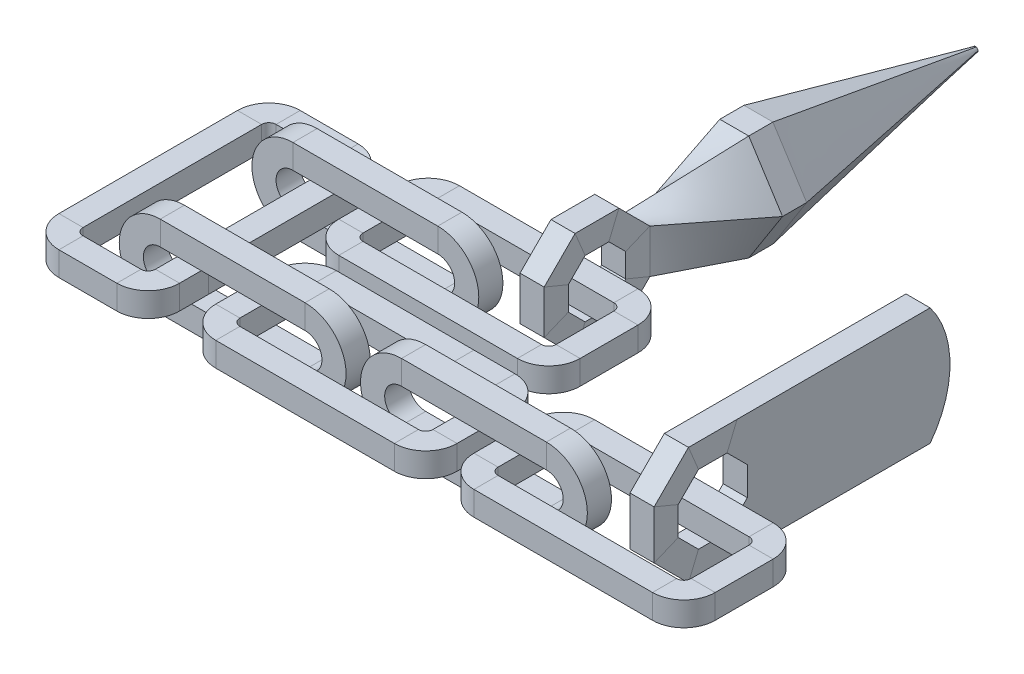
from build123d import *

# Parameters (mm, degrees)
CROQUIS2_W              = 5
CROQUIS2_H              = 5
CROQUIS8_W              = 5
CROQUIS8_H              = 5
CROQUIS11_W             = 5
CROQUIS11_H             = 5
CROQUIS17_W             = 5
CROQUIS17_H             = 5
CROQUIS19_W             = 5
CROQUIS19_H             = 5
CROQUIS22_W             = 5
CROQUIS22_H             = 5
CROQUIS28_W             = 5
CROQUIS28_H             = 5
SALIENTE_EXTRUIR2_DEPTH = 5
CROQUIS35_W             = 5
CROQUIS35_H             = 5
CROQUIS37_W             = 5
CROQUIS37_H             = 5
SALIENTE_EXTRUIR4_START = -5
SALIENTE_EXTRUIR4_DEPTH = 5


with BuildPart() as part:
    # Barrer1: sweep along a path in Croquis1
    with BuildLine(Plane.XY) as barrer1_path:
        Line((0, 0), (30, 0))
        ThreePointArc((30, 0), (36, 6), (30, 12))
        Line((30, 12), (0, 12))
        ThreePointArc((0, 12), (-6, 6), (0, 0))
    # Croquis2 → Barrer1 (sweep)
    with BuildSketch(Plane(origin=(0, 0, 0), x_dir=(0, 0, -1), z_dir=(1, 0, 0))):
        with Locations((0, 12)):
            Rectangle(CROQUIS2_W, CROQUIS2_H)
    sweep(path=barrer1_path.line)


with BuildPart() as body_2:
    # Barrer2: sweep along a path in Croquis7
    with BuildLine(Plane(origin=(0, 6, 0), x_dir=(1, 0, 0), z_dir=(0, 1, 0))) as barrer2_path:
        Line((-28.5, 10), (8.5, 10))
        ThreePointArc((8.5, 10), (11.328427125, 8.828427125), (12.5, 6))
        Line((12.5, 6), (12.5, -6))
        ThreePointArc((12.5, -6), (11.328427125, -8.828427125), (8.5, -10))
        Line((8.5, -10), (-28.5, -10))
        ThreePointArc((-28.5, -10), (-31.328427125, -8.828427125), (-32.5, -6))
        Line((-32.5, -6), (-32.5, 6))
        ThreePointArc((-32.5, 6), (-31.328427125, 8.828427125), (-28.5, 10))
    # Croquis8 → Barrer2 (sweep)
    with BuildSketch(Plane(origin=(0, 0, 0), x_dir=(0, 0, -1), z_dir=(1, 0, 0))):
        with Locations((10, 6)):
            Rectangle(CROQUIS8_W, CROQUIS8_H)
    sweep(path=barrer2_path.line)


with BuildPart() as body_3:
    # Barrer3: sweep along a path in Croquis10
    with BuildLine(Plane.XY) as barrer3_path:
        Line((-50, 0), (-20, 0))
        ThreePointArc((-20, 0), (-14, 6), (-20, 12))
        Line((-20, 12), (-50, 12))
        ThreePointArc((-50, 12), (-56, 6), (-50, 0))
    # Croquis11 → Barrer3 (sweep)
    with BuildSketch(Plane(origin=(-50, 0, 0), x_dir=(0, 0, -1), z_dir=(1, 0, 0))):
        with Locations((0, 12)):
            Rectangle(CROQUIS11_W, CROQUIS11_H)
    sweep(path=barrer3_path.line)


with BuildPart() as body_4:
    # Barrer6: sweep along a path in Croquis16
    with BuildLine(Plane(origin=(0, 6, 0), x_dir=(1, 0, 0), z_dir=(0, 1, 0))) as barrer6_path:
        Line((-45, 0), (-45, -6))
        ThreePointArc((-45, -6), (-46.171572875, -8.828427125), (-49, -10))
        Line((-49, -10), (-61, -10))
        ThreePointArc((-61, -10), (-63.828427125, -8.828427125), (-65, -6))
        Line((-65, -6), (-65, 31))
        ThreePointArc((-65, 31), (-63.828427125, 33.828427125), (-61, 35))
        Line((-61, 35), (-49, 35))
        ThreePointArc((-49, 35), (-46.171572875, 33.828427125), (-45, 31))
        Line((-45, 31), (-45, 0))
    # Croquis17 → Barrer6 (sweep)
    with BuildSketch(Plane.XY.offset(-31)):
        with Locations((-65, 6)):
            Rectangle(CROQUIS17_W, CROQUIS17_H)
    sweep(path=barrer6_path.line)


with BuildPart() as body_5:
    # Barrer7: sweep along a path in Croquis18
    with BuildLine(Plane(origin=(0, 0, -27.5), x_dir=(-1, 0, 0), z_dir=(0, 0, -1))) as barrer7_path:
        Line((20, 0), (50, 0))
        ThreePointArc((50, 0), (56, 6), (50, 12))
        Line((50, 12), (20, 12))
        ThreePointArc((20, 12), (14, 6), (20, 0))
    # Croquis19 → Barrer7 (sweep)
    with BuildSketch(Plane(origin=(-20, 0, 0), x_dir=(0, 0, -1), z_dir=(1, 0, 0))):
        with Locations((27.5, 0)):
            Rectangle(CROQUIS19_W, CROQUIS19_H)
    sweep(path=barrer7_path.line)


with BuildPart() as body_6:
    # Barrer8: sweep along a path in Croquis21
    with BuildLine(Plane(origin=(0, 6, 0), x_dir=(1, 0, 0), z_dir=(0, 1, 0))) as barrer8_path:
        Line((-31, 37.996379446), (6, 37.996379446))
        ThreePointArc((6, 37.996379446), (8.828427125, 36.824806571), (10, 33.996379446))
        Line((10, 33.996379446), (10, 21.996379446))
        ThreePointArc((10, 21.996379446), (8.828427125, 19.167952321), (6, 17.996379446))
        Line((6, 17.996379446), (-31, 17.996379446))
        ThreePointArc((-31, 17.996379446), (-33.828427125, 19.167952321), (-35, 21.996379446))
        Line((-35, 21.996379446), (-35, 33.996379446))
        ThreePointArc((-35, 33.996379446), (-33.828427125, 36.824806571), (-31, 37.996379446))
    # Croquis22 → Barrer8 (sweep)
    with BuildSketch(Plane(origin=(6, 0, 0), x_dir=(0, 0, -1), z_dir=(1, 0, 0))):
        with Locations((37.996379446, 6)):
            Rectangle(CROQUIS22_W, CROQUIS22_H)
    sweep(path=barrer8_path.line)


with BuildPart() as body_7:
    # Barrer11: sweep along a path in Croquis24
    with BuildLine(Plane(origin=(-2, 0, 0), x_dir=(0, 0, -1), z_dir=(1, 0, 0))) as barrer11_path:
        Line((33.996379446, 0.050252532), (40.996379446, 0.050252532))
        Line((40.996379446, 0.050252532), (45.946126914, 5))
        Line((45.946126914, 5), (45.946126914, 12))
        Line((45.946126914, 12), (40.996379446, 16.949747468))
        Line((40.996379446, 16.949747468), (33.996379446, 16.949747468))
        Line((33.996379446, 16.949747468), (29.046631978, 12))
        Line((29.046631978, 12), (29.046631978, 5))
        Line((29.046631978, 5), (33.996379446, 0.050252532))
    # Croquis28 → Barrer11 (sweep)
    with BuildSketch(Plane(origin=(0, 12, 0), x_dir=(1, 0, 0), z_dir=(0, 1, 0))):
        with Locations((-2, 45.946126914)):
            Rectangle(CROQUIS28_W, CROQUIS28_H)
    sweep(path=barrer11_path.line, transition=Transition.RIGHT)

    # Recubrir1: read off the stored shape, not the designer's step
    # Recubrir1: loft between two sections, ruled curve by curve
    recubrir1_from = [
        Edge.make_bspline([(8, 8.5, -68.446126914), (1, 19.449747468, -68.446126914)], [0, 0, 1, 1], 1),
        Edge.make_bspline([(1, 19.449747468, -68.446126914), (0.75, 19.449747468, -68.446126914), (0.25, 19.449747468, -68.446126914), (-0.5, 19.449747468, -68.446126914), (-1.25, 19.449747468, -68.446126914), (-1.75, 19.449747468, -68.446126914), (-2.25, 19.449747468, -68.446126914), (-2.75, 19.449747468, -68.446126914), (-3.5, 19.449747468, -68.446126914), (-4.25, 19.449747468, -68.446126914), (-4.75, 19.449747468, -68.446126914), (-5, 19.449747468, -68.446126914)], [0, 0, 0, 0, 0.125, 0.25, 0.375, 0.5, 0.5, 0.625, 0.75, 0.875, 1, 1, 1, 1], 3),
        Edge.make_bspline([(1, -2.449747468, -68.446126914), (8, 8.5, -68.446126914)], [0, 0, 1, 1], 1),
        Edge.make_bspline([(-5, 19.449747468, -68.446126914), (-12, 8.5, -68.446126914)], [0, 0, 1, 1], 1),
        Edge.make_bspline([(-12, 8.5, -68.446126914), (-5, -2.449747468, -68.446126914)], [0, 0, 1, 1], 1),
        Edge.make_line((-5, -2.449747468, -68.446126914), (1, -2.449747468, -68.446126914)),
    ]
    recubrir1_to = [
        Edge.make_bspline([(0.5, 13.035533906, -48.446126914), (-4.5, 13.035533906, -48.446126914)], [0, 0, 1, 1], 1),
        Edge.make_bspline([(-4.5, 13.035533906, -48.446126914), (-4.5, 12.916152848, -48.446126914), (-4.5, 12.677390733, -48.446126914), (-4.5, 12.319247559, -48.446126914), (-4.5, 11.961104386, -48.446126914), (-4.5, 11.722342271, -48.446126914), (-4.5, 11.483580155, -48.446126914), (-4.5, 11.24481804, -48.446126914), (-4.5, 10.886674866, -48.446126914), (-4.5, 10.528531693, -48.446126914), (-4.5, 10.289769578, -48.446126914), (-4.5, 10.17038852, -48.446126914)], [0, 0, 0, 0, 0.125, 0.25, 0.375, 0.5, 0.5, 0.625, 0.75, 0.875, 1, 1, 1, 1], 3),
        Edge.make_bspline([(0.5, 3.964466094, -48.446126914), (0.5, 13.035533906, -48.446126914)], [0, 0, 1, 1], 1),
        Edge.make_bspline([(-4.5, 10.17038852, -48.446126914), (-4.5, 3.964466094, -48.446126914)], [0, 0, 1, 1], 1),
        Edge.make_bspline([(-4.5, 3.964466094, -48.446126914), (-1.079276798, 3.964466094, -48.446126914)], [0, 0, 1, 1], 1),
        Edge.make_line((-1.079276798, 3.964466094, -48.446126914), (0.5, 3.964466094, -48.446126914)),
    ]
    recubrir1 = Solid(Shell([*[Face.make_surface_from_curves(recubrir1_from[k], recubrir1_to[k]) for k in range(6)], Face(Wire(recubrir1_from)), Face(Wire(recubrir1_to))]))
    add(recubrir1)

    # Croquis31 → Saliente-Extruir2 (add)
    with BuildSketch(Plane(origin=(0, 0, -68.446126914), x_dir=(-1, 0, 0), z_dir=(0, 0, -1))):
        Polygon((-1, 19.449747468), (2, 19.449747468), (5, 19.449747468), (12, 8.5), (5, -2.449747468), (2, -2.449747468), (-1, -2.449747468), (-8, 8.5), align=None)
    extrude(amount=SALIENTE_EXTRUIR2_DEPTH)

    # Recubrir2: read off the stored shape, not the designer's step
    # Recubrir2: loft between two sections, ruled curve by curve
    recubrir2_from = [
        Edge.make_bspline([(-1.5, 8.5, -118.446126914), (-1.5, 8.601088464, -118.446126914), (-1.534156666, 8.713718085, -118.446126914), (-1.670783331, 8.892812699, -118.446126914), (-1.770384142, 8.955516669, -118.446126914), (-1.867879592, 8.982228367, -118.446126914)], [0, 0, 0, 0, 0.5, 0.5, 1, 1, 1, 1], 3),
        Edge.make_bspline([(-1.867879592, 8.982228367, -118.446126914), (-1.910354398, 8.993865568, -118.446126914), (-1.955177199, 8.999684169, -118.446126914), (-2.044822801, 8.999684169, -118.446126914), (-2.089645602, 8.993865568, -118.446126914), (-2.132120408, 8.982228367, -118.446126914)], [0, 0, 0, 0, 0.5, 0.5, 1, 1, 1, 1], 3),
        Edge.make_bspline([(-1.867879592, 8.017771633, -118.446126914), (-1.770384142, 8.044483331, -118.446126914), (-1.670783331, 8.107187301, -118.446126914), (-1.534156666, 8.286281915, -118.446126914), (-1.5, 8.398911536, -118.446126914), (-1.5, 8.5, -118.446126914)], [0, 0, 0, 0, 0.5, 0.5, 1, 1, 1, 1], 3),
        Edge.make_bspline([(-2.132120408, 8.982228367, -118.446126914), (-2.229615858, 8.955516669, -118.446126914), (-2.329216669, 8.892812699, -118.446126914), (-2.465843334, 8.713718085, -118.446126914), (-2.5, 8.601088464, -118.446126914), (-2.5, 8.5, -118.446126914)], [0, 0, 0, 0, 0.5, 0.5, 1, 1, 1, 1], 3),
        Edge.make_bspline([(-2.5, 8.5, -118.446126914), (-2.5, 8.398911536, -118.446126914), (-2.465843334, 8.286281915, -118.446126914), (-2.329216669, 8.107187301, -118.446126914), (-2.229615858, 8.044483331, -118.446126914), (-2.132120408, 8.017771633, -118.446126914)], [0, 0, 0, 0, 0.5, 0.5, 1, 1, 1, 1], 3),
        Edge.make_bspline([(-2.132120408, 8.017771633, -118.446126914), (-2.089645602, 8.006134432, -118.446126914), (-2.044822801, 8.000315831, -118.446126914), (-1.955177199, 8.000315831, -118.446126914), (-1.910354398, 8.006134432, -118.446126914), (-1.867879592, 8.017771633, -118.446126914)], [0, 0, 0, 0, 0.5, 0.5, 1, 1, 1, 1], 3),
    ]
    recubrir2_to = [
        Edge.make_bspline([(8, 8.5, -73.446126914), (6.833333333, 10.324957911, -73.446126914), (5.666666667, 12.149915823, -73.446126914), (3.333333333, 15.799831646, -73.446126914), (2.166666667, 17.624789557, -73.446126914), (1, 19.449747468, -73.446126914)], [0, 0, 0, 0, 0.5, 0.5, 1, 1, 1, 1], 3),
        Edge.make_bspline([(1, 19.449747468, -73.446126914), (0, 19.449747468, -73.446126914), (-1, 19.449747468, -73.446126914), (-3, 19.449747468, -73.446126914), (-4, 19.449747468, -73.446126914), (-5, 19.449747468, -73.446126914)], [0, 0, 0, 0, 0.5, 0.5, 1, 1, 1, 1], 3),
        Edge.make_bspline([(1, -2.449747468, -73.446126914), (2.166666667, -0.624789557, -73.446126914), (3.333333333, 1.200168354, -73.446126914), (5.666666667, 4.850084177, -73.446126914), (6.833333333, 6.675042089, -73.446126914), (8, 8.5, -73.446126914)], [0, 0, 0, 0, 0.5, 0.5, 1, 1, 1, 1], 3),
        Edge.make_bspline([(-5, 19.449747468, -73.446126914), (-6.166666667, 17.624789557, -73.446126914), (-7.333333333, 15.799831646, -73.446126914), (-9.666666667, 12.149915823, -73.446126914), (-10.833333333, 10.324957911, -73.446126914), (-12, 8.5, -73.446126914)], [0, 0, 0, 0, 0.5, 0.5, 1, 1, 1, 1], 3),
        Edge.make_bspline([(-12, 8.5, -73.446126914), (-10.833333333, 6.675042089, -73.446126914), (-9.666666667, 4.850084177, -73.446126914), (-7.333333333, 1.200168354, -73.446126914), (-6.166666667, -0.624789557, -73.446126914), (-5, -2.449747468, -73.446126914)], [0, 0, 0, 0, 0.5, 0.5, 1, 1, 1, 1], 3),
        Edge.make_bspline([(-5, -2.449747468, -73.446126914), (-4, -2.449747468, -73.446126914), (-3, -2.449747468, -73.446126914), (-1, -2.449747468, -73.446126914), (0, -2.449747468, -73.446126914), (1, -2.449747468, -73.446126914)], [0, 0, 0, 0, 0.5, 0.5, 1, 1, 1, 1], 3),
    ]
    recubrir2 = Solid(Shell([*[Face.make_surface_from_curves(recubrir2_from[k], recubrir2_to[k]) for k in range(6)], Face(Wire(recubrir2_from)), Face(Wire(recubrir2_to))]))
    add(recubrir2)


with BuildPart() as body_8:
    # Barrer13: sweep along a path in Croquis14
    with BuildLine(Plane(origin=(0, 6, 0), x_dir=(1, 0, 0), z_dir=(0, 1, 0))) as barrer13_path:
        Line((25, 10), (62, 10))
        ThreePointArc((62, 10), (64.828427125, 8.828427125), (66, 6))
        Line((66, 6), (66, -6))
        ThreePointArc((66, -6), (64.828427125, -8.828427125), (62, -10))
        Line((62, -10), (25, -10))
        ThreePointArc((25, -10), (22.171572875, -8.828427125), (21, -6))
        Line((21, -6), (21, 6))
        ThreePointArc((21, 6), (22.171572875, 8.828427125), (25, 10))
    # Croquis35 → Barrer13 (sweep)
    with BuildSketch(Plane(origin=(43.5, 0, 0), x_dir=(0, 0, -1), z_dir=(1, 0, 0))):
        with Locations((10, 6)):
            Rectangle(CROQUIS35_W, CROQUIS35_H)
    sweep(path=barrer13_path.line)


with BuildPart() as body_9:
    # Barrer14: sweep along a path in Croquis36
    with BuildLine(Plane(origin=(50.5, 0, 0), x_dir=(0, 0, -1), z_dir=(1, 0, 0))) as barrer14_path:
        Line((-0.666503965, 5.656854249), (4.990350284, 0))
        Line((4.990350284, 0), (12.990350284, 0))
        Line((12.990350284, 0), (18.647204534, 5.656854249))
        Line((18.647204534, 5.656854249), (18.647204534, 13.656854249))
        Line((18.647204534, 13.656854249), (12.990350284, 19.313708499))
        Line((12.990350284, 19.313708499), (4.990350284, 19.313708499))
        Line((4.990350284, 19.313708499), (-0.666503965, 13.656854249))
        Line((-0.666503965, 13.656854249), (-0.666503965, 5.656854249))
    # Croquis37 → Barrer14 (sweep)
    with BuildSketch(Plane(origin=(0, 0, -12.990350284), x_dir=(-1, 0, 0), z_dir=(0, 0, -1))):
        with Locations((-50.5, 19.313708499)):
            Rectangle(CROQUIS37_W, CROQUIS37_H)
    sweep(path=barrer14_path.line, transition=Transition.RIGHT)

    # Croquis38 → Saliente-Extruir4 (add)
    with BuildSketch(Plane(origin=(53, 0, 0), x_dir=(0, 0, -1), z_dir=(1, 0, 0)).offset(SALIENTE_EXTRUIR4_START)):
        with BuildLine():
            Line((14.02588419, -2.5), (54.02588419, -2.5))
            ThreePointArc((54.02588419, -2.5), (58.144735153, 9.656854249), (54.02588419, 21.813708499))
            Line((54.02588419, 21.813708499), (14.02588419, 21.813708499))
            Line((14.02588419, 21.813708499), (21.147204534, 14.692388155))
            Line((21.147204534, 14.692388155), (21.147204534, 4.621320344))
            Line((21.147204534, 4.621320344), (14.02588419, -2.5))
        make_face()
    extrude(amount=SALIENTE_EXTRUIR4_DEPTH)


solid = Compound([part.part, body_2.part, body_3.part, body_4.part, body_5.part, body_6.part, body_7.part, body_8.part, body_9.part])
